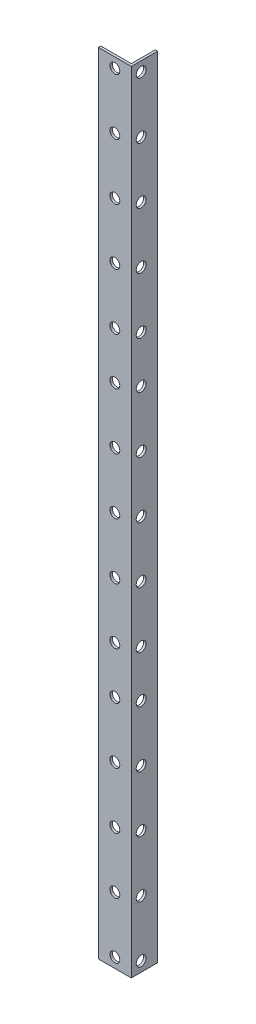
from build123d import *

# Parameters (mm, degrees)
BOSS_EXTRUDE1_DEPTH        = 360
CUT_EXTRUDE1_REACH         = 362.468
SKETCH2_R                  = 2.25
CUT_EXTRUDE2_REACH         = 362.512
SKETCH3_R                  = 2.25
LPATTERN1_COUNT            = 5
LPATTERN1_PITCH            = 25.65625
LPATTERN2_COPY_1_REACH     = 362.512
LPATTERN2_COPY_1_SKETCH_R  = 2.25
LPATTERN2_COPY_2_REACH     = 362.512
LPATTERN2_COPY_2_SKETCH_R  = 2.25
LPATTERN2_COPY_3_REACH     = 362.512
LPATTERN2_COPY_3_SKETCH_R  = 2.25
LPATTERN2_COPY_4_REACH     = 362.512
LPATTERN2_COPY_4_SKETCH_R  = 2.25
LPATTERN2_COPY_5_REACH     = 362.512
LPATTERN2_COPY_5_SKETCH_R  = 2.25
LPATTERN2_COPY_6_REACH     = 362.512
LPATTERN2_COPY_6_SKETCH_R  = 2.25
LPATTERN2_COPY_7_REACH     = 362.512
LPATTERN2_COPY_7_SKETCH_R  = 2.25
LPATTERN2_COPY_8_REACH     = 362.512
LPATTERN2_COPY_8_SKETCH_R  = 2.25
LPATTERN2_COPY_9_REACH     = 362.512
LPATTERN2_COPY_9_SKETCH_R  = 2.25
LPATTERN2_COPY_10_REACH    = 362.512
LPATTERN2_COPY_10_SKETCH_R = 2.25


with BuildPart() as part:
    # Sketch1 → Boss-Extrude1 (new body)
    with BuildSketch(Plane(origin=(0, 0, 0), x_dir=(1, 0, 0), z_dir=(0, 1, 0))):
        Polygon((0, 0), (15, 0), (15, 12), (13.9, 12), (13.9, 1.1), (0, 1.1), align=None)
    extrude(amount=BOSS_EXTRUDE1_DEPTH)

    # Sketch2 → Cut-Extrude1 (cut, up to next)
    with BuildSketch(Plane.ZY.offset(-13.9), mode=Mode.PRIVATE) as cut_extrude1_sk1:
        with Locations((-4.5, 329.8125)):
            Circle(SKETCH2_R)
    cut_extrude1_tool1 = extrude(cut_extrude1_sk1.sketch, amount=-CUT_EXTRUDE1_REACH, mode=Mode.PRIVATE) & part.part
    # Sketch2 → Cut-Extrude1 (cut, up to next)
    with BuildSketch(Plane.ZY.offset(-13.9), mode=Mode.PRIVATE) as cut_extrude1_sk2:
        with Locations((-4.5, 304.125)):
            Circle(SKETCH2_R)
    cut_extrude1_tool2 = extrude(cut_extrude1_sk2.sketch, amount=-CUT_EXTRUDE1_REACH, mode=Mode.PRIVATE) & part.part
    # Sketch2 → Cut-Extrude1 (cut, up to next)
    with BuildSketch(Plane.ZY.offset(-13.9), mode=Mode.PRIVATE) as cut_extrude1_sk3:
        with Locations((-4.5, 278.4375)):
            Circle(SKETCH2_R)
    cut_extrude1_tool3 = extrude(cut_extrude1_sk3.sketch, amount=-CUT_EXTRUDE1_REACH, mode=Mode.PRIVATE) & part.part
    # Sketch2 → Cut-Extrude1 (cut, up to next)
    with BuildSketch(Plane.ZY.offset(-13.9), mode=Mode.PRIVATE) as cut_extrude1_sk4:
        with Locations((-4.5, 252.75)):
            Circle(SKETCH2_R)
    cut_extrude1_tool4 = extrude(cut_extrude1_sk4.sketch, amount=-CUT_EXTRUDE1_REACH, mode=Mode.PRIVATE) & part.part
    # Sketch2 → Cut-Extrude1 (cut, up to next)
    with BuildSketch(Plane.ZY.offset(-13.9), mode=Mode.PRIVATE) as cut_extrude1_sk5:
        with Locations((-4.5, 231.375)):
            Circle(SKETCH2_R)
    cut_extrude1_tool5 = extrude(cut_extrude1_sk5.sketch, amount=-CUT_EXTRUDE1_REACH, mode=Mode.PRIVATE) & part.part
    # Sketch2 → Cut-Extrude1 (cut, up to next)
    with BuildSketch(Plane.ZY.offset(-13.9), mode=Mode.PRIVATE) as cut_extrude1_sk6:
        with Locations((-4.5, 205.6875)):
            Circle(SKETCH2_R)
    cut_extrude1_tool6 = extrude(cut_extrude1_sk6.sketch, amount=-CUT_EXTRUDE1_REACH, mode=Mode.PRIVATE) & part.part
    # Sketch2 → Cut-Extrude1 (cut, up to next)
    with BuildSketch(Plane.ZY.offset(-13.9), mode=Mode.PRIVATE) as cut_extrude1_sk7:
        with Locations((-4.5, 180)):
            Circle(SKETCH2_R)
    cut_extrude1_tool7 = extrude(cut_extrude1_sk7.sketch, amount=-CUT_EXTRUDE1_REACH, mode=Mode.PRIVATE) & part.part
    # Sketch2 → Cut-Extrude1 (cut, up to next)
    with BuildSketch(Plane.ZY.offset(-13.9), mode=Mode.PRIVATE) as cut_extrude1_sk8:
        with Locations((-4.5, 154.3125)):
            Circle(SKETCH2_R)
    cut_extrude1_tool8 = extrude(cut_extrude1_sk8.sketch, amount=-CUT_EXTRUDE1_REACH, mode=Mode.PRIVATE) & part.part
    # Sketch2 → Cut-Extrude1 (cut, up to next)
    with BuildSketch(Plane.ZY.offset(-13.9), mode=Mode.PRIVATE) as cut_extrude1_sk9:
        with Locations((-4.5, 128.625)):
            Circle(SKETCH2_R)
    cut_extrude1_tool9 = extrude(cut_extrude1_sk9.sketch, amount=-CUT_EXTRUDE1_REACH, mode=Mode.PRIVATE) & part.part
    # Sketch2 → Cut-Extrude1 (cut, up to next)
    with BuildSketch(Plane.ZY.offset(-13.9), mode=Mode.PRIVATE) as cut_extrude1_sk10:
        with Locations((-4.5, 107.25)):
            Circle(SKETCH2_R)
    cut_extrude1_tool10 = extrude(cut_extrude1_sk10.sketch, amount=-CUT_EXTRUDE1_REACH, mode=Mode.PRIVATE) & part.part
    # Sketch2 → Cut-Extrude1 (cut, up to next)
    with BuildSketch(Plane.ZY.offset(-13.9), mode=Mode.PRIVATE) as cut_extrude1_sk11:
        with Locations((-4.5, 81.5625)):
            Circle(SKETCH2_R)
    cut_extrude1_tool11 = extrude(cut_extrude1_sk11.sketch, amount=-CUT_EXTRUDE1_REACH, mode=Mode.PRIVATE) & part.part
    # Sketch2 → Cut-Extrude1 (cut, up to next)
    with BuildSketch(Plane.ZY.offset(-13.9), mode=Mode.PRIVATE) as cut_extrude1_sk12:
        with Locations((-4.5, 55.875)):
            Circle(SKETCH2_R)
    cut_extrude1_tool12 = extrude(cut_extrude1_sk12.sketch, amount=-CUT_EXTRUDE1_REACH, mode=Mode.PRIVATE) & part.part
    # Sketch2 → Cut-Extrude1 (cut, up to next)
    with BuildSketch(Plane.ZY.offset(-13.9), mode=Mode.PRIVATE) as cut_extrude1_sk13:
        with Locations((-4.5, 30.1875)):
            Circle(SKETCH2_R)
    cut_extrude1_tool13 = extrude(cut_extrude1_sk13.sketch, amount=-CUT_EXTRUDE1_REACH, mode=Mode.PRIVATE) & part.part
    # Sketch2 → Cut-Extrude1 (cut, up to next)
    with BuildSketch(Plane.ZY.offset(-13.9), mode=Mode.PRIVATE) as cut_extrude1_sk14:
        with Locations((-4.5, 4.5)):
            Circle(SKETCH2_R)
    cut_extrude1_tool14 = extrude(cut_extrude1_sk14.sketch, amount=-CUT_EXTRUDE1_REACH, mode=Mode.PRIVATE) & part.part
    # Sketch2 → Cut-Extrude1 (cut, up to next)
    with BuildSketch(Plane.ZY.offset(-13.9), mode=Mode.PRIVATE) as cut_extrude1_sk15:
        with Locations((-4.5, 355.5)):
            Circle(SKETCH2_R)
    cut_extrude1_tool15 = extrude(cut_extrude1_sk15.sketch, amount=-CUT_EXTRUDE1_REACH, mode=Mode.PRIVATE) & part.part
    add(cut_extrude1_tool1.solids().sort_by_distance((13.9, 329.8125, -4.5))[0], mode=Mode.SUBTRACT)
    add(cut_extrude1_tool2.solids().sort_by_distance((13.9, 304.125, -4.5))[0], mode=Mode.SUBTRACT)
    add(cut_extrude1_tool3.solids().sort_by_distance((13.9, 278.4375, -4.5))[0], mode=Mode.SUBTRACT)
    add(cut_extrude1_tool4.solids().sort_by_distance((13.9, 252.75, -4.5))[0], mode=Mode.SUBTRACT)
    add(cut_extrude1_tool5.solids().sort_by_distance((13.9, 231.375, -4.5))[0], mode=Mode.SUBTRACT)
    add(cut_extrude1_tool6.solids().sort_by_distance((13.9, 205.6875, -4.5))[0], mode=Mode.SUBTRACT)
    add(cut_extrude1_tool7.solids().sort_by_distance((13.9, 180, -4.5))[0], mode=Mode.SUBTRACT)
    add(cut_extrude1_tool8.solids().sort_by_distance((13.9, 154.3125, -4.5))[0], mode=Mode.SUBTRACT)
    add(cut_extrude1_tool9.solids().sort_by_distance((13.9, 128.625, -4.5))[0], mode=Mode.SUBTRACT)
    add(cut_extrude1_tool10.solids().sort_by_distance((13.9, 107.25, -4.5))[0], mode=Mode.SUBTRACT)
    add(cut_extrude1_tool11.solids().sort_by_distance((13.9, 81.5625, -4.5))[0], mode=Mode.SUBTRACT)
    add(cut_extrude1_tool12.solids().sort_by_distance((13.9, 55.875, -4.5))[0], mode=Mode.SUBTRACT)
    add(cut_extrude1_tool13.solids().sort_by_distance((13.9, 30.1875, -4.5))[0], mode=Mode.SUBTRACT)
    add(cut_extrude1_tool14.solids().sort_by_distance((13.9, 4.5, -4.5))[0], mode=Mode.SUBTRACT)
    add(cut_extrude1_tool15.solids().sort_by_distance((13.9, 355.5, -4.5))[0], mode=Mode.SUBTRACT)

    # Sketch3 → Cut-Extrude2 (cut, up to next)
    with BuildSketch(Plane.XY, mode=Mode.PRIVATE) as cut_extrude2_sk1:
        with Locations((7.5, 355.5)):
            Circle(SKETCH3_R)
    cut_extrude2_tool1 = extrude(cut_extrude2_sk1.sketch, amount=-CUT_EXTRUDE2_REACH, mode=Mode.PRIVATE) & part.part
    cut_extrude2 = cut_extrude2_tool1.solids().sort_by_distance((7.5, 355.5, 0))[0]
    add(cut_extrude2, mode=Mode.SUBTRACT)

    # LPattern1: Cut-Extrude2 ×5
    with Locations(*[(0, -i * LPATTERN1_PITCH, 0) for i in range(1, LPATTERN1_COUNT)]):
        add(cut_extrude2, mode=Mode.SUBTRACT)

    # LPattern2 copy 1 sketch → LPattern2 copy 1 (cut, up to next)
    with BuildSketch(Plane(origin=(0, -149.84375, 0), x_dir=(1, 0, 0), z_dir=(0, 0, 1)), mode=Mode.PRIVATE) as lpattern2_copy_1_sk1:
        with Locations((7.5, 355.5)):
            Circle(LPATTERN2_COPY_1_SKETCH_R)
    lpattern2_copy_1_tool1 = extrude(lpattern2_copy_1_sk1.sketch, amount=-LPATTERN2_COPY_1_REACH, mode=Mode.PRIVATE) & part.part
    add(lpattern2_copy_1_tool1.solids().sort_by_distance((7.5, 205.65625, 0))[0], mode=Mode.SUBTRACT)

    # LPattern2 copy 2 sketch → LPattern2 copy 2 (cut, up to next)
    with BuildSketch(Plane(origin=(0, -274.03125, 0), x_dir=(1, 0, 0), z_dir=(0, 0, 1)), mode=Mode.PRIVATE) as lpattern2_copy_2_sk1:
        with Locations((7.5, 355.5)):
            Circle(LPATTERN2_COPY_2_SKETCH_R)
    lpattern2_copy_2_tool1 = extrude(lpattern2_copy_2_sk1.sketch, amount=-LPATTERN2_COPY_2_REACH, mode=Mode.PRIVATE) & part.part
    add(lpattern2_copy_2_tool1.solids().sort_by_distance((7.5, 81.46875, 0))[0], mode=Mode.SUBTRACT)

    # LPattern2 copy 3 sketch → LPattern2 copy 3 (cut, up to next)
    with BuildSketch(Plane(origin=(0, -175.5, 0), x_dir=(1, 0, 0), z_dir=(0, 0, 1)), mode=Mode.PRIVATE) as lpattern2_copy_3_sk1:
        with Locations((7.5, 355.5)):
            Circle(LPATTERN2_COPY_3_SKETCH_R)
    lpattern2_copy_3_tool1 = extrude(lpattern2_copy_3_sk1.sketch, amount=-LPATTERN2_COPY_3_REACH, mode=Mode.PRIVATE) & part.part
    add(lpattern2_copy_3_tool1.solids().sort_by_distance((7.5, 180, 0))[0], mode=Mode.SUBTRACT)

    # LPattern2 copy 4 sketch → LPattern2 copy 4 (cut, up to next)
    with BuildSketch(Plane(origin=(0, -299.6875, 0), x_dir=(1, 0, 0), z_dir=(0, 0, 1)), mode=Mode.PRIVATE) as lpattern2_copy_4_sk1:
        with Locations((7.5, 355.5)):
            Circle(LPATTERN2_COPY_4_SKETCH_R)
    lpattern2_copy_4_tool1 = extrude(lpattern2_copy_4_sk1.sketch, amount=-LPATTERN2_COPY_4_REACH, mode=Mode.PRIVATE) & part.part
    add(lpattern2_copy_4_tool1.solids().sort_by_distance((7.5, 55.8125, 0))[0], mode=Mode.SUBTRACT)

    # LPattern2 copy 5 sketch → LPattern2 copy 5 (cut, up to next)
    with BuildSketch(Plane(origin=(0, -201.15625, 0), x_dir=(1, 0, 0), z_dir=(0, 0, 1)), mode=Mode.PRIVATE) as lpattern2_copy_5_sk1:
        with Locations((7.5, 355.5)):
            Circle(LPATTERN2_COPY_5_SKETCH_R)
    lpattern2_copy_5_tool1 = extrude(lpattern2_copy_5_sk1.sketch, amount=-LPATTERN2_COPY_5_REACH, mode=Mode.PRIVATE) & part.part
    add(lpattern2_copy_5_tool1.solids().sort_by_distance((7.5, 154.34375, 0))[0], mode=Mode.SUBTRACT)

    # LPattern2 copy 6 sketch → LPattern2 copy 6 (cut, up to next)
    with BuildSketch(Plane(origin=(0, -325.34375, 0), x_dir=(1, 0, 0), z_dir=(0, 0, 1)), mode=Mode.PRIVATE) as lpattern2_copy_6_sk1:
        with Locations((7.5, 355.5)):
            Circle(LPATTERN2_COPY_6_SKETCH_R)
    lpattern2_copy_6_tool1 = extrude(lpattern2_copy_6_sk1.sketch, amount=-LPATTERN2_COPY_6_REACH, mode=Mode.PRIVATE) & part.part
    add(lpattern2_copy_6_tool1.solids().sort_by_distance((7.5, 30.15625, 0))[0], mode=Mode.SUBTRACT)

    # LPattern2 copy 7 sketch → LPattern2 copy 7 (cut, up to next)
    with BuildSketch(Plane(origin=(0, -226.8125, 0), x_dir=(1, 0, 0), z_dir=(0, 0, 1)), mode=Mode.PRIVATE) as lpattern2_copy_7_sk1:
        with Locations((7.5, 355.5)):
            Circle(LPATTERN2_COPY_7_SKETCH_R)
    lpattern2_copy_7_tool1 = extrude(lpattern2_copy_7_sk1.sketch, amount=-LPATTERN2_COPY_7_REACH, mode=Mode.PRIVATE) & part.part
    add(lpattern2_copy_7_tool1.solids().sort_by_distance((7.5, 128.6875, 0))[0], mode=Mode.SUBTRACT)

    # LPattern2 copy 8 sketch → LPattern2 copy 8 (cut, up to next)
    with BuildSketch(Plane(origin=(0, -351, 0), x_dir=(1, 0, 0), z_dir=(0, 0, 1)), mode=Mode.PRIVATE) as lpattern2_copy_8_sk1:
        with Locations((7.5, 355.5)):
            Circle(LPATTERN2_COPY_8_SKETCH_R)
    lpattern2_copy_8_tool1 = extrude(lpattern2_copy_8_sk1.sketch, amount=-LPATTERN2_COPY_8_REACH, mode=Mode.PRIVATE) & part.part
    add(lpattern2_copy_8_tool1.solids().sort_by_distance((7.5, 4.5, 0))[0], mode=Mode.SUBTRACT)

    # LPattern2 copy 9 sketch → LPattern2 copy 9 (cut, up to next)
    with BuildSketch(Plane(origin=(0, -124.1875, 0), x_dir=(1, 0, 0), z_dir=(0, 0, 1)), mode=Mode.PRIVATE) as lpattern2_copy_9_sk1:
        with Locations((7.5, 355.5)):
            Circle(LPATTERN2_COPY_9_SKETCH_R)
    lpattern2_copy_9_tool1 = extrude(lpattern2_copy_9_sk1.sketch, amount=-LPATTERN2_COPY_9_REACH, mode=Mode.PRIVATE) & part.part
    add(lpattern2_copy_9_tool1.solids().sort_by_distance((7.5, 231.3125, 0))[0], mode=Mode.SUBTRACT)

    # LPattern2 copy 10 sketch → LPattern2 copy 10 (cut, up to next)
    with BuildSketch(Plane(origin=(0, -248.375, 0), x_dir=(1, 0, 0), z_dir=(0, 0, 1)), mode=Mode.PRIVATE) as lpattern2_copy_10_sk1:
        with Locations((7.5, 355.5)):
            Circle(LPATTERN2_COPY_10_SKETCH_R)
    lpattern2_copy_10_tool1 = extrude(lpattern2_copy_10_sk1.sketch, amount=-LPATTERN2_COPY_10_REACH, mode=Mode.PRIVATE) & part.part
    add(lpattern2_copy_10_tool1.solids().sort_by_distance((7.5, 107.125, 0))[0], mode=Mode.SUBTRACT)


solid = part.part
